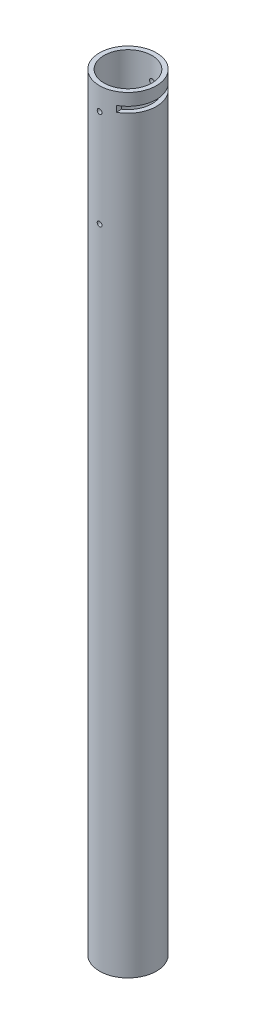
from build123d import *

# Parameters (mm, degrees)
SKETCH1_R               = 30.1625
SKETCH1_R_2             = 25.4
BOSS_EXTRUDE1_DEPTH     = 812.8
CUT_EXTRUDE2_DEPTH      = 814.918541878
CUT_EXTRUDE2_DEPTH_BACK = 814.918541878
SKETCH4_W               = 15.875
SKETCH4_H               = 6.35
SKETCH4_R               = 2.54


with BuildPart() as part:
    # Sketch1 → Boss-Extrude1 (new body)
    with BuildSketch(Plane(origin=(0, 0, 0), x_dir=(1, 0, 0), z_dir=(0, 1, 0))):
        Circle(SKETCH1_R)
        Circle(SKETCH1_R_2, mode=Mode.SUBTRACT)
    extrude(amount=BOSS_EXTRUDE1_DEPTH)

    # Sketch4 → Cut-Extrude2 (cut, two sides: drawn at the far end of the back side and taken through both)
    with BuildSketch(Plane.XY.offset(-CUT_EXTRUDE2_DEPTH_BACK)):
        with Locations((22.225, 796.925)):
            Rectangle(SKETCH4_W, SKETCH4_H)
        with Locations((0, 788.9875)):
            Circle(SKETCH4_R)
        with Locations((0, 685.8)):
            Circle(SKETCH4_R)
    extrude(amount=CUT_EXTRUDE2_DEPTH + CUT_EXTRUDE2_DEPTH_BACK, mode=Mode.SUBTRACT)


solid = part.part
